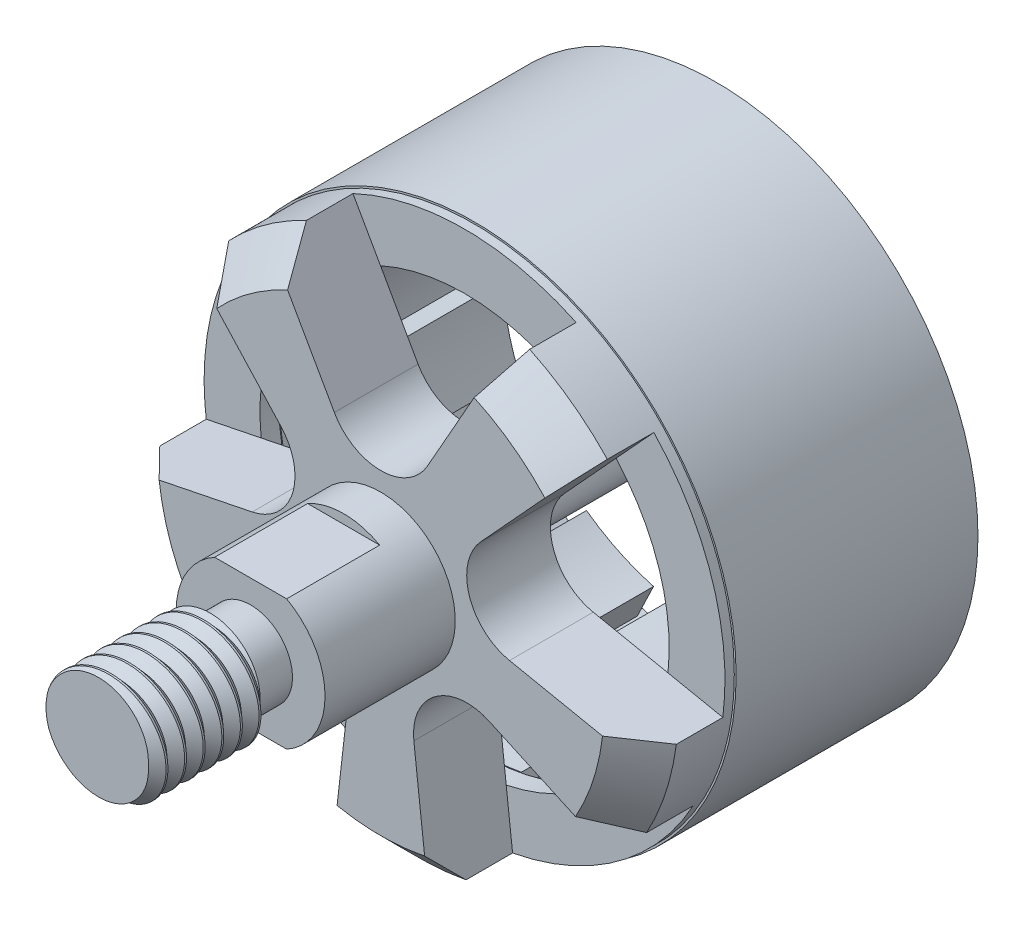
from build123d import *

# Parameters (mm, degrees)
CUT_EXTRUDE1_DEPTH     = 4.5
BOSS_EXTRUDE1_START    = 1
SKETCH4_R              = 13
SKETCH4_R_2            = 11
BOSS_EXTRUDE1_DEPTH    = 1
BOSS_EXTRUDE2_DEPTH    = 12
BOSS_EXTRUDE2_2_DEPTH  = 12
BOSS_EXTRUDE2_3_DEPTH  = 12
BOSS_EXTRUDE2_4_DEPTH  = 12
BOSS_EXTRUDE2_5_DEPTH  = 12
BOSS_EXTRUDE2_6_DEPTH  = 12
BOSS_EXTRUDE2_7_DEPTH  = 12
BOSS_EXTRUDE2_8_DEPTH  = 12
BOSS_EXTRUDE2_9_DEPTH  = 12
BOSS_EXTRUDE2_10_DEPTH = 12
BOSS_EXTRUDE2_11_DEPTH = 12
BOSS_EXTRUDE2_12_DEPTH = 12
BOSS_EXTRUDE2_13_DEPTH = 12
BOSS_EXTRUDE2_14_DEPTH = 12
SKETCH6_W              = 4.892087208
SKETCH6_H              = 1
CUT_EXTRUDE2_DEPTH     = 5
CUT_SWEEP1_PITCH       = 1
SKETCH10_R             = 14.1
SKETCH10_R_2           = 14
BOSS_EXTRUDE3_DEPTH    = 13
SKETCH11_W             = 0.5
SKETCH11_H             = 0.5


with BuildPart() as part:
    # Sketch2 → Revolve1 (revolve)
    with BuildSketch(Plane(origin=(0, 0, 0), x_dir=(1, 0, 0), z_dir=(0, 1, 0)), mode=Mode.PRIVATE) as revolve1_sk:
        Polygon((14, 33), (14, 17), (12, 15), (4, 15), (4, 8), (2.25, 8), (2.25, 6), (3, 6), (3, 0), (0, 0), (0, 40.5), (1.5, 40.5), (1.5, 19.5), (13, 19.5), (13, 33), align=None)
    revolve(revolve1_sk.sketch.rotate(Axis((0, 0, -62.930713813), (0, 0, 1)), 180), axis=Axis((0, 0, -62.930713813), (0, 0, 1)))

    # Sketch3 → Cut-Extrude1 (cut)
    with BuildSketch(Plane.XY.offset(-15)):
        with BuildLine():
            Line((-6, 12.649110641), (-2.5, 6.458468796))
            ThreePointArc((-2.5, 6.458468796), (0, 5), (2.5, 6.458468796))
            Line((2.5, 6.458468796), (6, 12.649110641))
            ThreePointArc((6, 12.649110641), (0, 14), (-6, 12.649110641))
        make_face()
        with BuildLine():
            Line((10.175917134, 9.615129249), (5.369826348, 4.373417906))
            ThreePointArc((5.369826348, 4.373417906), (4.755282581, 1.545084972), (6.91491132, -0.381864675))
            Line((6.91491132, -0.381864675), (13.884121066, -1.797548946))
            ThreePointArc((13.884121066, -1.797548946), (13.314791228, 4.326237921), (10.175917134, 9.615129249))
        make_face()
        with BuildLine():
            Line((12.289062655, -6.706633958), (5.818735197, -3.755547883))
            ThreePointArc((5.818735197, -3.755547883), (2.938926261, -4.045084972), (1.773650225, -6.694474144))
            Line((1.773650225, -6.694474144), (2.580858723, -13.760056986))
            ThreePointArc((2.580858723, -13.760056986), (8.228993532, -11.326237921), (12.289062655, -6.706633958))
        make_face()
        with BuildLine():
            Line((-2.580858723, -13.760056986), (-1.773650225, -6.694474144))
            ThreePointArc((-1.773650225, -6.694474144), (-2.938926261, -4.045084972), (-5.818735197, -3.755547883))
            Line((-5.818735197, -3.755547883), (-12.289062655, -6.706633958))
            ThreePointArc((-12.289062655, -6.706633958), (-8.228993532, -11.326237921), (-2.580858723, -13.760056986))
        make_face()
        with BuildLine():
            Line((-13.884121066, -1.797548946), (-6.91491132, -0.381864675))
            ThreePointArc((-6.91491132, -0.381864675), (-4.755282581, 1.545084972), (-5.369826348, 4.373417906))
            Line((-5.369826348, 4.373417906), (-10.175917134, 9.615129249))
            ThreePointArc((-10.175917134, 9.615129249), (-13.314791228, 4.326237921), (-13.884121066, -1.797548946))
        make_face()
    extrude(amount=-CUT_EXTRUDE1_DEPTH, mode=Mode.SUBTRACT)

    # Sketch4 → Boss-Extrude1 (add)
    with BuildSketch(Plane(origin=(0, 0, -19.5), x_dir=(-1, 0, 0), z_dir=(0, 0, -1)).offset(BOSS_EXTRUDE1_START)):
        Circle(SKETCH4_R)
        with Locations(Location((0, 0, 0), (0, 0, 186.254454166))):
            Circle(SKETCH4_R_2, mode=Mode.SUBTRACT)
    extrude(amount=-BOSS_EXTRUDE1_DEPTH)

    # Sketch6 → Cut-Extrude2 (cut)
    with BuildSketch(Plane.XY.offset(-8)):
        with Locations((0, 4)):
            Rectangle(SKETCH6_W, SKETCH6_H)
        with Locations((0, -4)):
            Rectangle(SKETCH6_W, SKETCH6_H)
    extrude(amount=-CUT_EXTRUDE2_DEPTH, mode=Mode.SUBTRACT)

    # Cut-Sweep1: arcs per turn and ends read off the stored shape
    # Cut-Sweep1: the profile of Sketch9 screwed along a right-hand helix through 7.5 turns, 8 arcs to a turn; built about Z, then put on its axis
    cut_sweep1_z = Axis((0, 0, 0), (0, 0, 1))
    cut_sweep1_corners = [(2.5, 0, -1), (3.05, 0, -0.505086687), (3.05, 0, -1.494913313)]
    with BuildLine(mode=Mode.PRIVATE) as cut_sweep1_profile:
        Line(cut_sweep1_corners[0], cut_sweep1_corners[1])
        Line(cut_sweep1_corners[1], cut_sweep1_corners[2])
        Line(cut_sweep1_corners[2], cut_sweep1_corners[0])
    cut_sweep1_cap = Face(cut_sweep1_profile.wire())
    cut_sweep1_turn_angles = [0, 22.5, 45, 67.5, 90, 112.5, 135, 157.5, 180, 202.5, 225, 247.5, 270, 292.5, 315, 337.5, 360]
    cut_sweep1_turn_weights = [1, 0.9238795325112867, 1, 0.9238795325112867, 1, 0.9238795325112867, 1, 0.9238795325112867, 1, 0.9238795325112867, 1, 0.9238795325112867, 1, 0.9238795325112867, 1, 0.9238795325112867, 1]
    cut_sweep1_turn_rails = [Edge.make_bspline([Vector(p[0], p[1], 0).rotate(cut_sweep1_z, cut_sweep1_turn_angles[k]) / cut_sweep1_turn_weights[k] + Vector(0, 0, p[2] + CUT_SWEEP1_PITCH * cut_sweep1_turn_angles[k] / 360) for k in range(17)], [0, 0, 0, 1, 1, 2, 2, 3, 3, 4, 4, 5, 5, 6, 6, 7, 7, 8, 8, 8], 2, cut_sweep1_turn_weights) for p in cut_sweep1_corners]
    cut_sweep1_turn_sides = [Face.make_surface_from_curves(cut_sweep1_turn_rails[p[0]], cut_sweep1_turn_rails[p[1]]) for p in [(0, 1), (1, 2), (2, 0)]]
    cut_sweep1_last_angles = [2520, 2542.5, 2565, 2587.5, 2610, 2632.5, 2655, 2677.5, 2700]
    cut_sweep1_last_weights = [1, 0.9238795325112867, 1, 0.9238795325112867, 1, 0.9238795325112867, 1, 0.9238795325112867, 1]
    cut_sweep1_last_rails = [Edge.make_bspline([Vector(p[0], p[1], 0).rotate(cut_sweep1_z, cut_sweep1_last_angles[k]) / cut_sweep1_last_weights[k] + Vector(0, 0, p[2] + CUT_SWEEP1_PITCH * cut_sweep1_last_angles[k] / 360) for k in range(9)], [0, 0, 0, 1, 1, 2, 2, 3, 3, 4, 4, 4], 2, cut_sweep1_last_weights) for p in cut_sweep1_corners]
    cut_sweep1_last_sides = [Face.make_surface_from_curves(cut_sweep1_last_rails[p[0]], cut_sweep1_last_rails[p[1]]) for p in [(0, 1), (1, 2), (2, 0)]]
    cut_sweep1 = Plane(origin=(0, 0, 0), x_dir=(1, 0, 0), z_dir=(0, 0, -1)) * Solid(Shell([*[p.moved(Location((0, 0, CUT_SWEEP1_PITCH * i))) for i in range(7) for p in cut_sweep1_turn_sides], *cut_sweep1_last_sides, cut_sweep1_cap, cut_sweep1_cap.rotate(cut_sweep1_z, 2700).moved(Location((0, 0, CUT_SWEEP1_PITCH * 2700 / 360)))]))
    add(cut_sweep1, mode=Mode.SUBTRACT)

    # Sketch11 → Cut-Revolve1 (revolve, cut)
    with BuildSketch(Plane(origin=(0, 0, 0), x_dir=(1, 0, 0), z_dir=(0, 1, 0))):
        with Locations((-1.5, 39.25)):
            Rectangle(SKETCH11_W, SKETCH11_H)
    revolve(axis=Axis((0, 0, -40.5), (0, 0, -1)), mode=Mode.SUBTRACT)


with BuildPart() as body_2:
    # Sketch5 → Boss-Extrude2 (new body)
    with BuildSketch(Plane(origin=(0, 0, -32.55), x_dir=(-1, 0, 0), z_dir=(0, 0, -1))):
        with BuildLine():
            Line((-2, 12.845232579), (-2, 10.816653826))
            ThreePointArc((-2, 10.816653826), (0, 11), (2, 10.816653826))
            Line((2, 10.816653826), (2, 12.845232579))
            ThreePointArc((2, 12.845232579), (0, 13), (-2, 12.845232579))
        make_face()
    extrude(amount=-BOSS_EXTRUDE2_DEPTH)


with BuildPart() as body_3:
    # Sketch5 → Boss-Extrude2 2 (new body)
    with BuildSketch(Plane(origin=(0, 0, -32.55), x_dir=(-1, 0, 0), z_dir=(0, 0, -1))):
        with BuildLine():
            Line((3.771399805, 12.440922133), (2.891232471, 10.613235831))
            ThreePointArc((2.891232471, 10.613235831), (4.77272113, 9.910657547), (6.495107943, 8.877700874))
            Line((6.495107943, 8.877700874), (7.375275277, 10.705387176))
            ThreePointArc((7.375275277, 10.705387176), (5.640488609, 11.712595283), (3.771399805, 12.440922133))
        make_face()
    extrude(amount=-BOSS_EXTRUDE2_2_DEPTH)


with BuildPart() as body_4:
    # Sketch5 → Boss-Extrude2 3 (new body)
    with BuildSketch(Plane(origin=(0, 0, -32.55), x_dir=(-1, 0, 0), z_dir=(0, 0, -1))):
        with BuildLine():
            Line((8.795827626, 9.57253448), (7.209820893, 8.307736316))
            ThreePointArc((7.209820893, 8.307736316), (8.600146307, 6.85838782), (9.7037801, 5.180410386))
            Line((9.7037801, 5.180410386), (11.289786833, 6.44520855))
            ThreePointArc((11.289786833, 6.44520855), (10.163809272, 8.105367424), (8.795827626, 9.57253448))
        make_face()
    extrude(amount=-BOSS_EXTRUDE2_3_DEPTH)


with BuildPart() as body_5:
    # Sketch5 → Boss-Extrude2 4 (new body)
    with BuildSketch(Plane(origin=(0, 0, -32.55), x_dir=(-1, 0, 0), z_dir=(0, 0, -1))):
        with BuildLine():
            Line((12.078133911, 4.808188975), (10.100415864, 4.356787736))
            ThreePointArc((10.100415864, 4.356787736), (10.724207034, 2.447730274), (10.9904996, 0.457076087))
            Line((10.9904996, 0.457076087), (12.968217647, 0.908477326))
            ThreePointArc((12.968217647, 0.908477326), (12.674062858, 2.892772141), (12.078133911, 4.808188975))
        make_face()
    extrude(amount=-BOSS_EXTRUDE2_4_DEPTH)


with BuildPart() as body_6:
    # Sketch5 → Boss-Extrude2 5 (new body)
    with BuildSketch(Plane(origin=(0, 0, -32.55), x_dir=(-1, 0, 0), z_dir=(0, 0, -1))):
        with BuildLine():
            Line((12.968217647, -0.908477326), (10.9904996, -0.457076087))
            ThreePointArc((10.9904996, -0.457076087), (10.724207034, -2.447730274), (10.100415864, -4.356787736))
            Line((10.100415864, -4.356787736), (12.078133911, -4.808188975))
            ThreePointArc((12.078133911, -4.808188975), (12.674062858, -2.892772141), (12.968217647, -0.908477326))
        make_face()
    extrude(amount=-BOSS_EXTRUDE2_5_DEPTH)


with BuildPart() as body_7:
    # Sketch5 → Boss-Extrude2 6 (new body)
    with BuildSketch(Plane(origin=(0, 0, -32.55), x_dir=(-1, 0, 0), z_dir=(0, 0, -1))):
        with BuildLine():
            Line((11.289786833, -6.44520855), (9.7037801, -5.180410386))
            ThreePointArc((9.7037801, -5.180410386), (8.600146307, -6.85838782), (7.209820893, -8.307736316))
            Line((7.209820893, -8.307736316), (8.795827626, -9.57253448))
            ThreePointArc((8.795827626, -9.57253448), (10.163809272, -8.105367424), (11.289786833, -6.44520855))
        make_face()
    extrude(amount=-BOSS_EXTRUDE2_6_DEPTH)


with BuildPart() as body_8:
    # Sketch5 → Boss-Extrude2 7 (new body)
    with BuildSketch(Plane(origin=(0, 0, -32.55), x_dir=(-1, 0, 0), z_dir=(0, 0, -1))):
        with BuildLine():
            Line((7.375275277, -10.705387176), (6.495107943, -8.877700874))
            ThreePointArc((6.495107943, -8.877700874), (4.77272113, -9.910657547), (2.891232471, -10.613235831))
            Line((2.891232471, -10.613235831), (3.771399805, -12.440922133))
            ThreePointArc((3.771399805, -12.440922133), (5.640488609, -11.712595283), (7.375275277, -10.705387176))
        make_face()
    extrude(amount=-BOSS_EXTRUDE2_7_DEPTH)


with BuildPart() as body_9:
    # Sketch5 → Boss-Extrude2 8 (new body)
    with BuildSketch(Plane(origin=(0, 0, -32.55), x_dir=(-1, 0, 0), z_dir=(0, 0, -1))):
        with BuildLine():
            Line((2, -12.845232579), (2, -10.816653826))
            ThreePointArc((2, -10.816653826), (0, -11), (-2, -10.816653826))
            Line((-2, -10.816653826), (-2, -12.845232579))
            ThreePointArc((-2, -12.845232579), (0, -13), (2, -12.845232579))
        make_face()
    extrude(amount=-BOSS_EXTRUDE2_8_DEPTH)


with BuildPart() as body_10:
    # Sketch5 → Boss-Extrude2 9 (new body)
    with BuildSketch(Plane(origin=(0, 0, -32.55), x_dir=(-1, 0, 0), z_dir=(0, 0, -1))):
        with BuildLine():
            Line((-3.771399805, -12.440922133), (-2.891232471, -10.613235831))
            ThreePointArc((-2.891232471, -10.613235831), (-4.77272113, -9.910657547), (-6.495107943, -8.877700874))
            Line((-6.495107943, -8.877700874), (-7.375275277, -10.705387176))
            ThreePointArc((-7.375275277, -10.705387176), (-5.640488609, -11.712595283), (-3.771399805, -12.440922133))
        make_face()
    extrude(amount=-BOSS_EXTRUDE2_9_DEPTH)


with BuildPart() as body_11:
    # Sketch5 → Boss-Extrude2 10 (new body)
    with BuildSketch(Plane(origin=(0, 0, -32.55), x_dir=(-1, 0, 0), z_dir=(0, 0, -1))):
        with BuildLine():
            Line((-8.795827626, -9.57253448), (-7.209820893, -8.307736316))
            ThreePointArc((-7.209820893, -8.307736316), (-8.600146307, -6.85838782), (-9.7037801, -5.180410386))
            Line((-9.7037801, -5.180410386), (-11.289786833, -6.44520855))
            ThreePointArc((-11.289786833, -6.44520855), (-10.163809272, -8.105367424), (-8.795827626, -9.57253448))
        make_face()
    extrude(amount=-BOSS_EXTRUDE2_10_DEPTH)


with BuildPart() as body_12:
    # Sketch5 → Boss-Extrude2 11 (new body)
    with BuildSketch(Plane(origin=(0, 0, -32.55), x_dir=(-1, 0, 0), z_dir=(0, 0, -1))):
        with BuildLine():
            Line((-12.078133911, -4.808188975), (-10.100415864, -4.356787736))
            ThreePointArc((-10.100415864, -4.356787736), (-10.724207034, -2.447730274), (-10.9904996, -0.457076087))
            Line((-10.9904996, -0.457076087), (-12.968217647, -0.908477326))
            ThreePointArc((-12.968217647, -0.908477326), (-12.674062858, -2.892772141), (-12.078133911, -4.808188975))
        make_face()
    extrude(amount=-BOSS_EXTRUDE2_11_DEPTH)


with BuildPart() as body_13:
    # Sketch5 → Boss-Extrude2 12 (new body)
    with BuildSketch(Plane(origin=(0, 0, -32.55), x_dir=(-1, 0, 0), z_dir=(0, 0, -1))):
        with BuildLine():
            Line((-12.968217647, 0.908477326), (-10.9904996, 0.457076087))
            ThreePointArc((-10.9904996, 0.457076087), (-10.724207034, 2.447730274), (-10.100415864, 4.356787736))
            Line((-10.100415864, 4.356787736), (-12.078133911, 4.808188975))
            ThreePointArc((-12.078133911, 4.808188975), (-12.674062858, 2.892772141), (-12.968217647, 0.908477326))
        make_face()
    extrude(amount=-BOSS_EXTRUDE2_12_DEPTH)


with BuildPart() as body_14:
    # Sketch5 → Boss-Extrude2 13 (new body)
    with BuildSketch(Plane(origin=(0, 0, -32.55), x_dir=(-1, 0, 0), z_dir=(0, 0, -1))):
        with BuildLine():
            Line((-11.289786833, 6.44520855), (-9.7037801, 5.180410386))
            ThreePointArc((-9.7037801, 5.180410386), (-8.600146307, 6.85838782), (-7.209820893, 8.307736316))
            Line((-7.209820893, 8.307736316), (-8.795827626, 9.57253448))
            ThreePointArc((-8.795827626, 9.57253448), (-10.163809272, 8.105367424), (-11.289786833, 6.44520855))
        make_face()
    extrude(amount=-BOSS_EXTRUDE2_13_DEPTH)


with BuildPart() as body_15:
    # Sketch5 → Boss-Extrude2 14 (new body)
    with BuildSketch(Plane(origin=(0, 0, -32.55), x_dir=(-1, 0, 0), z_dir=(0, 0, -1))):
        with BuildLine():
            Line((-7.375275277, 10.705387176), (-6.495107943, 8.877700874))
            ThreePointArc((-6.495107943, 8.877700874), (-4.77272113, 9.910657547), (-2.891232471, 10.613235831))
            Line((-2.891232471, 10.613235831), (-3.771399805, 12.440922133))
            ThreePointArc((-3.771399805, 12.440922133), (-5.640488609, 11.712595283), (-7.375275277, 10.705387176))
        make_face()
    extrude(amount=-BOSS_EXTRUDE2_14_DEPTH)


with BuildPart() as body_16:
    # Sketch10 → Boss-Extrude3 (new body)
    with BuildSketch(Plane(origin=(0, 0, -33), x_dir=(-1, 0, 0), z_dir=(0, 0, -1))):
        Circle(SKETCH10_R)
        Circle(SKETCH10_R_2, mode=Mode.SUBTRACT)
    extrude(amount=-BOSS_EXTRUDE3_DEPTH)


solid = Compound([part.part, body_2.part, body_3.part, body_4.part, body_5.part, body_6.part, body_7.part, body_8.part, body_9.part, body_10.part, body_11.part, body_12.part, body_13.part, body_14.part, body_15.part, body_16.part])
